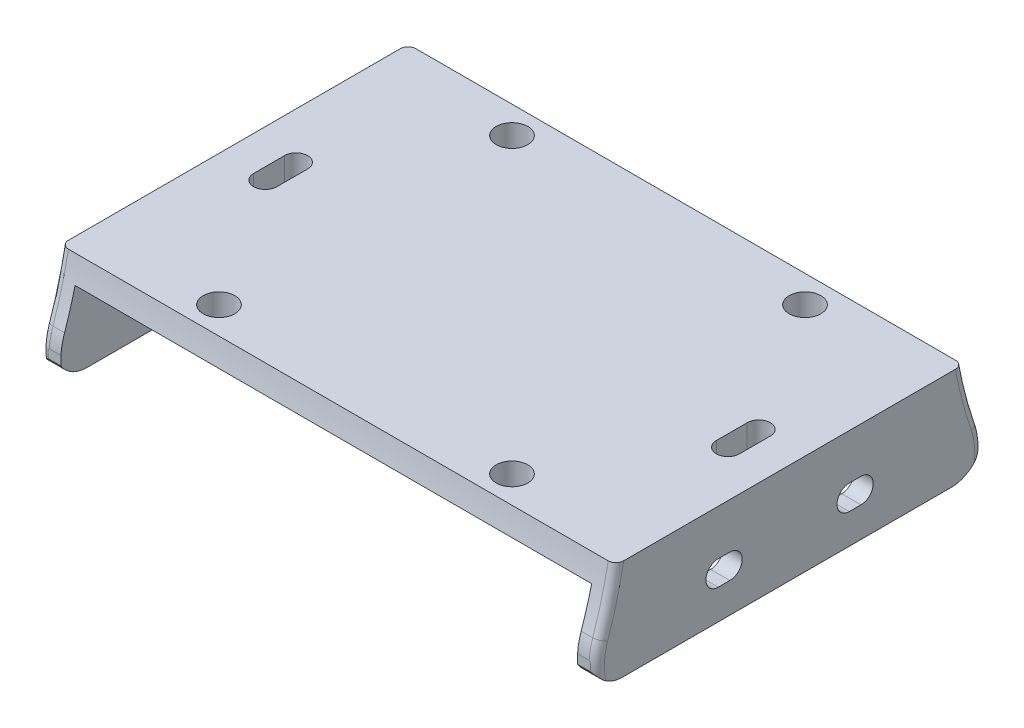
from build123d import *

# Parameters (mm, degrees)
BOSS_EXTRUDE1_DEPTH      = 40
BOSS_EXTRUDE1_DEPTH_BACK = 10
SKETCH1_W                = 73
SKETCH1_H                = 3
SKETCH1_W_2              = 3
SKETCH1_H_2              = 10
SKETCH5_R                = 2.05
CUT_EXTRUDE2_DEPTH       = 5.1
CUT_EXTRUDE3_DEPTH       = 82
SKETCH9_W                = 50
SKETCH9_H                = 13
CUT_EXTRUDE4_DEPTH       = 0.5
CUT_EXTRUDE5_DEPTH       = 98.5
FILLET2_R                = 4
FILLET3_R                = 1


with BuildPart() as part:
    # Sketch1 → Boss-Extrude1 (new, two sides: drawn at the far end of the back side and taken through both)
    with BuildSketch(Plane.XY.offset(-BOSS_EXTRUDE1_DEPTH_BACK)):
        with Locations((0, -34)):
            Rectangle(SKETCH1_W, SKETCH1_H)
        with Locations((35, -40.5)):
            Rectangle(SKETCH1_W_2, SKETCH1_H_2)
        with Locations((-35, -40.5)):
            Rectangle(SKETCH1_W_2, SKETCH1_H_2)
    extrude(amount=BOSS_EXTRUDE1_DEPTH + BOSS_EXTRUDE1_DEPTH_BACK)

    # Sketch5 → Cut-Extrude2 (cut)
    with BuildSketch(Plane(origin=(0, -32.5, 0), x_dir=(1, 0, 0), z_dir=(0, 1, 0))):
        with Locations(Location((-19, 4, 0), (0, 0, 270))):
            Circle(SKETCH5_R)
        with Locations(Location((19, 4, 0), (0, 0, 270))):
            Circle(SKETCH5_R)
        with Locations(Location((19, -34, 0), (0, 0, 270))):
            Circle(SKETCH5_R)
        with Locations(Location((-19, -34, 0), (0, 0, 270))):
            Circle(SKETCH5_R)
        with BuildLine():
            Line((-31.5, -17), (-31.5, -13))
            ThreePointArc((-31.5, -13), (-30, -11.5), (-28.5, -13))
            Line((-28.5, -13), (-28.5, -17))
            ThreePointArc((-28.5, -17), (-30, -18.5), (-31.5, -17))
        make_face()
        with BuildLine():
            Line((31.5, -13), (31.5, -17))
            ThreePointArc((31.5, -17), (30, -18.5), (28.5, -17))
            Line((28.5, -17), (28.5, -13))
            ThreePointArc((28.5, -13), (30, -11.5), (31.5, -13))
        make_face()
    extrude(amount=-CUT_EXTRUDE2_DEPTH, mode=Mode.SUBTRACT)

    # Sketch8 → Cut-Extrude3 (cut)
    with BuildSketch(Plane.ZY.offset(36.5)):
        with BuildLine():
            Line((5.75, -38.4), (7.25, -38.4))
            ThreePointArc((7.25, -38.4), (8.85, -40), (7.25, -41.6))
            Line((7.25, -41.6), (5.75, -41.6))
            ThreePointArc((5.75, -41.6), (4.15, -40), (5.75, -38.4))
        make_face()
        with BuildLine():
            Line((24.25, -38.4), (22.75, -38.4))
            ThreePointArc((22.75, -38.4), (21.15, -40), (22.75, -41.6))
            Line((22.75, -41.6), (24.25, -41.6))
            ThreePointArc((24.25, -41.6), (25.85, -40), (24.25, -38.4))
        make_face()
    extrude(amount=-CUT_EXTRUDE3_DEPTH, mode=Mode.SUBTRACT)

    # Sketch9 → Cut-Extrude4 (cut)
    with BuildSketch(Plane.ZY.offset(36.5)):
        with Locations((15, -39)):
            Rectangle(SKETCH9_W, SKETCH9_H)
    cut_extrude4 = extrude(amount=-CUT_EXTRUDE4_DEPTH, mode=Mode.SUBTRACT)

    # Mirror1: Cut-Extrude4 across plane
    add(cut_extrude4.mirror(Plane(origin=(0, 0, 0), x_dir=(0, 0, 1), z_dir=(1, 0, 0))), mode=Mode.SUBTRACT)

    # Sketch10 → Cut-Extrude5 (cut)
    with BuildSketch(Plane(origin=(36, 0, 0), x_dir=(0, 0, -1), z_dir=(1, 0, 0))):
        with BuildLine():
            Line((-39.673112404, -45.5), (-40.667568966, -46.550213702))
            Line((-40.667568966, -46.550213702), (-44.63224415, -43))
            Line((-44.63224415, -43), (-42.018495325, -33.98072497))
            Line((-42.018495325, -33.98072497), (-39.463482429, -29.927945893))
            Line((-39.463482429, -29.927945893), (-37.524182533, -32.5))
            ThreePointArc((-37.524182533, -32.5), (-38.383444331, -36.355587887), (-39.532044935, -40.135085929))
            ThreePointArc((-39.532044935, -40.135085929), (-40.017082913, -42.806643803), (-39.673112404, -45.5))
        make_face()
    cut_extrude5 = extrude(amount=-CUT_EXTRUDE5_DEPTH, mode=Mode.SUBTRACT)

    # Fillet2
    # the kernel refuses this fillet: 4 mm, written as the material it takes off along each edge
    with BuildSketch(Plane(origin=(23.5, -45.5, -10), x_dir=(0, 1, 0), z_dir=(1, 0, 0)), Plane(origin=(-46, -45.5, -10), x_dir=(0, 1, 0), z_dir=(1, 0, 0))) as fillet2_piece_1:
        with BuildLine():
            CenterArc((FILLET2_R, FILLET2_R), FILLET2_R, 180, 90)
            Line((0, FILLET2_R), (-FILLET2_R * 0.02, FILLET2_R))
            Line((-FILLET2_R * 0.02, FILLET2_R), (-FILLET2_R * 0.02, -FILLET2_R * 0.02))
            Line((-FILLET2_R * 0.02, -FILLET2_R * 0.02), (FILLET2_R, -FILLET2_R * 0.02))
            Line((FILLET2_R, -FILLET2_R * 0.02), (FILLET2_R, 0))
        make_face()
    extrude(amount=22.5, mode=Mode.SUBTRACT)
    with BuildSketch(Plane(origin=(43.633505106, -45.5, 39.673112404), x_dir=(0, 0, -1), z_dir=(-1, 0, 0)), Plane(origin=(-25.866494894, -45.5, 39.673112404), x_dir=(0, 0, -1), z_dir=(-1, 0, 0))) as fillet2_piece_2:
        with BuildLine():
            CenterArc((3.053402042, -4), FILLET2_R, 90, 57.679694788)
            Line((-0.326887596, -1.861392518), (-0.394493388, -1.818620368))
            ThreePointArc((-0.394493388, -1.818620368), (-0.291841099, -0.908147826), (-0.076877032, 0.022134181))
            Line((-0.076877032, 0.022134181), (0, 0.08))
            Line((0, 0.08), (3.053402042, 0.08))
            Line((3.053402042, 0.08), (3.053402042, 0))
        make_face()
    extrude(amount=17.767010212, mode=Mode.SUBTRACT)

    # Mirror2: Cut-Extrude5 across plane
    add(cut_extrude5.mirror(Plane.XY.offset(15)), mode=Mode.SUBTRACT)

    # Fillet3
    # the kernel refuses this fillet: 1 mm, written as the material it takes off along each edge
    with BuildSketch(Plane(origin=(36, -43.040322305, -1.130093667), x_dir=(0, 0.32679600244698914, -0.9450949014700414), z_dir=(0, 0.9450949014700414, 0.32679600244698914))) as fillet3_piece_1:
        with BuildLine():
            CenterArc((8.890060939 - FILLET3_R, FILLET3_R), FILLET3_R, 270, 90)
            Line((8.890060939 - FILLET3_R, 0), (8.890060939 - FILLET3_R, -FILLET3_R * 0.02))
            Line((8.890060939 - FILLET3_R, -FILLET3_R * 0.02), (8.890060939 + FILLET3_R * 0.02, -FILLET3_R * 0.02))
            Line((8.890060939 + FILLET3_R * 0.02, -FILLET3_R * 0.02), (8.890060939 + FILLET3_R * 0.02, FILLET3_R))
            Line((8.890060939 + FILLET3_R * 0.02, FILLET3_R), (8.890060939, FILLET3_R))
        make_face()
    revolve(axis=Axis((36, -43.040322305, -1.130093667), (-1, 0, 0)), revolution_arc=51.275424055, mode=Mode.SUBTRACT)
    with BuildSketch(Plane(origin=(36, -43.040322305, 31.130093667), x_dir=(0, 0.32679600244698914, 0.9450949014700414), z_dir=(0, 0.9450949014700414, -0.32679600244698914))) as fillet3_piece_2:
        with BuildLine():
            CenterArc((8.890060939 - FILLET3_R, -FILLET3_R), FILLET3_R, 0, 90)
            Line((8.890060939 - FILLET3_R, 0), (8.890060939 - FILLET3_R, FILLET3_R * 0.02))
            Line((8.890060939 - FILLET3_R, FILLET3_R * 0.02), (8.890060939 + FILLET3_R * 0.02, FILLET3_R * 0.02))
            Line((8.890060939 + FILLET3_R * 0.02, FILLET3_R * 0.02), (8.890060939 + FILLET3_R * 0.02, -FILLET3_R))
            Line((8.890060939 + FILLET3_R * 0.02, -FILLET3_R), (8.890060939, -FILLET3_R))
        make_face()
    revolve(axis=Axis((36, -43.040322305, 31.130093667), (1, 0, 0)), revolution_arc=53.885597182, mode=Mode.SUBTRACT)
    with BuildSketch(Plane(origin=(-36, -43.040322305, -1.130093667), x_dir=(0, -0.532891092697407, -0.8461838354186183), z_dir=(0, -0.8461838354186183, 0.532891092697407))) as fillet3_piece_3:
        with BuildLine():
            CenterArc((8.890060939 - FILLET3_R, FILLET3_R), FILLET3_R, 270, 90)
            Line((8.890060939, FILLET3_R), (8.890060939 + FILLET3_R * 0.02, FILLET3_R))
            Line((8.890060939 + FILLET3_R * 0.02, FILLET3_R), (8.890060939 + FILLET3_R * 0.02, -FILLET3_R * 0.02))
            Line((8.890060939 + FILLET3_R * 0.02, -FILLET3_R * 0.02), (8.890060939 - FILLET3_R, -FILLET3_R * 0.02))
            Line((8.890060939 - FILLET3_R, -FILLET3_R * 0.02), (8.890060939 - FILLET3_R, 0))
        make_face()
    revolve(axis=Axis((-36, -43.040322305, -1.130093667), (1, 0, 0)), revolution_arc=51.275424055, mode=Mode.SUBTRACT)
    with BuildSketch(Plane(origin=(-36, -43.040322305, 31.130093667), x_dir=(0, 0.32679600244698914, 0.9450949014700414), z_dir=(0, 0.9450949014700414, -0.32679600244698914))) as fillet3_piece_4:
        with BuildLine():
            CenterArc((8.890060939 - FILLET3_R, FILLET3_R), FILLET3_R, 270, 90)
            Line((8.890060939 - FILLET3_R, 0), (8.890060939 - FILLET3_R, -FILLET3_R * 0.02))
            Line((8.890060939 - FILLET3_R, -FILLET3_R * 0.02), (8.890060939 + FILLET3_R * 0.02, -FILLET3_R * 0.02))
            Line((8.890060939 + FILLET3_R * 0.02, -FILLET3_R * 0.02), (8.890060939 + FILLET3_R * 0.02, FILLET3_R))
            Line((8.890060939 + FILLET3_R * 0.02, FILLET3_R), (8.890060939, FILLET3_R))
        make_face()
    revolve(axis=Axis((-36, -43.040322305, 31.130093667), (1, 0, 0)), revolution_arc=53.885597182, mode=Mode.SUBTRACT)
    with BuildSketch(Plane(origin=(36, -23.090673742, -58.824529959), x_dir=(0, -0.06631180934399998, 0.9977989496594617), z_dir=(0, 0.9977989496594617, 0.06631180934399998))) as fillet3_piece_5:
        with BuildLine():
            CenterArc((52.156122044 + FILLET3_R, -FILLET3_R), FILLET3_R, 90, 90)
            Line((52.156122044 + FILLET3_R, 0), (52.156122044 + FILLET3_R, FILLET3_R * 0.02))
            Line((52.156122044 + FILLET3_R, FILLET3_R * 0.02), (52.156122044 - FILLET3_R * 0.02, FILLET3_R * 0.02))
            Line((52.156122044 - FILLET3_R * 0.02, FILLET3_R * 0.02), (52.156122044 - FILLET3_R * 0.02, -FILLET3_R))
            Line((52.156122044 - FILLET3_R * 0.02, -FILLET3_R), (52.156122044, -FILLET3_R))
        make_face()
    revolve(axis=Axis((36, -23.090673742, -58.824529959), (1, 0, 0)), revolution_arc=15.272244004, mode=Mode.SUBTRACT)
    with BuildSketch(Plane(origin=(36, -23.090673742, 88.824529959), x_dir=(0, -0.06631180934399998, -0.9977989496594617), z_dir=(0, 0.9977989496594617, -0.06631180934399998))) as fillet3_piece_6:
        with BuildLine():
            CenterArc((52.156122044 + FILLET3_R, FILLET3_R), FILLET3_R, 180, 90)
            Line((52.156122044 + FILLET3_R, 0), (52.156122044 + FILLET3_R, -FILLET3_R * 0.02))
            Line((52.156122044 + FILLET3_R, -FILLET3_R * 0.02), (52.156122044 - FILLET3_R * 0.02, -FILLET3_R * 0.02))
            Line((52.156122044 - FILLET3_R * 0.02, -FILLET3_R * 0.02), (52.156122044 - FILLET3_R * 0.02, FILLET3_R))
            Line((52.156122044 - FILLET3_R * 0.02, FILLET3_R), (52.156122044, FILLET3_R))
        make_face()
    revolve(axis=Axis((36, -23.090673742, 88.824529959), (-1, 0, 0)), revolution_arc=15.272244004, mode=Mode.SUBTRACT)
    with BuildSketch(Plane(origin=(-36, -23.090673742, -58.824529959), x_dir=(0, -0.06631180934399998, 0.9977989496594617), z_dir=(0, 0.9977989496594617, 0.06631180934399998))) as fillet3_piece_7:
        with BuildLine():
            CenterArc((52.156122044 + FILLET3_R, FILLET3_R), FILLET3_R, 180, 90)
            Line((52.156122044 + FILLET3_R, 0), (52.156122044 + FILLET3_R, -FILLET3_R * 0.02))
            Line((52.156122044 + FILLET3_R, -FILLET3_R * 0.02), (52.156122044 - FILLET3_R * 0.02, -FILLET3_R * 0.02))
            Line((52.156122044 - FILLET3_R * 0.02, -FILLET3_R * 0.02), (52.156122044 - FILLET3_R * 0.02, FILLET3_R))
            Line((52.156122044 - FILLET3_R * 0.02, FILLET3_R), (52.156122044, FILLET3_R))
        make_face()
    revolve(axis=Axis((-36, -23.090673742, -58.824529959), (1, 0, 0)), revolution_arc=15.272244004, mode=Mode.SUBTRACT)
    with BuildSketch(Plane(origin=(-36, -23.090673742, 88.824529959), x_dir=(0, -0.32679600244698953, -0.9450949014700414), z_dir=(0, -0.9450949014700414, 0.32679600244698953))) as fillet3_piece_8:
        with BuildLine():
            CenterArc((52.156122044 + FILLET3_R, FILLET3_R), FILLET3_R, 180, 90)
            Line((52.156122044 + FILLET3_R, 0), (52.156122044 + FILLET3_R, -FILLET3_R * 0.02))
            Line((52.156122044 + FILLET3_R, -FILLET3_R * 0.02), (52.156122044 - FILLET3_R * 0.02, -FILLET3_R * 0.02))
            Line((52.156122044 - FILLET3_R * 0.02, -FILLET3_R * 0.02), (52.156122044 - FILLET3_R * 0.02, FILLET3_R))
            Line((52.156122044 - FILLET3_R * 0.02, FILLET3_R), (52.156122044, FILLET3_R))
        make_face()
    revolve(axis=Axis((-36, -23.090673742, 88.824529959), (1, 0, 0)), revolution_arc=15.272244004, mode=Mode.SUBTRACT)


solid = part.part
